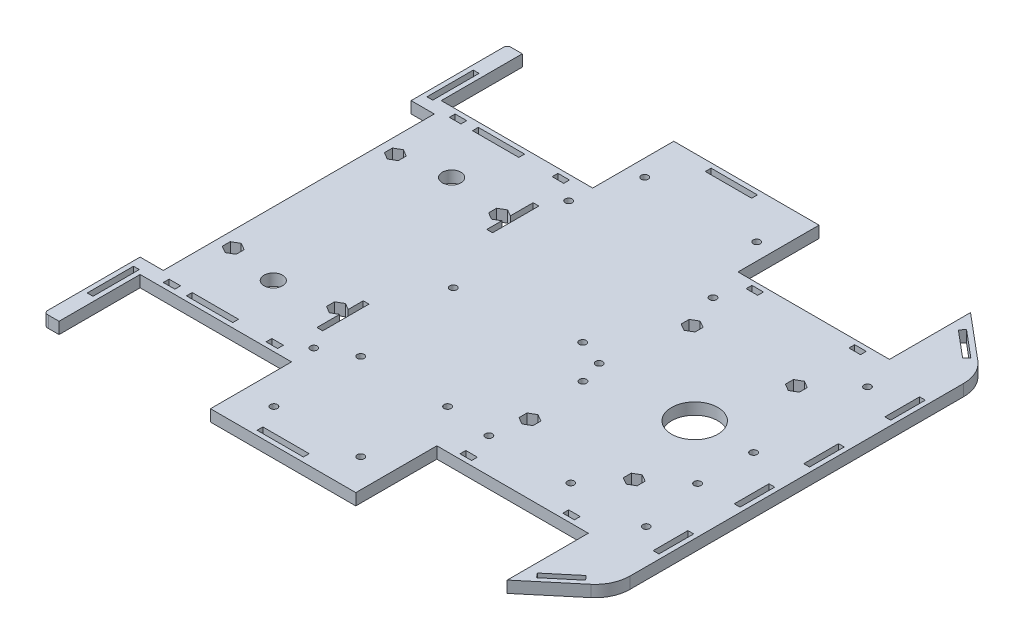
from build123d import *

# Parameters (mm, degrees)
SKETCH1_W           = 2.5
SKETCH1_H           = 20
SKETCH1_W_2         = 5
SKETCH1_H_2         = 2.5
SKETCH1_W_3         = 20
SKETCH1_R           = 1.5
SKETCH1_R_2         = 4
SKETCH1_H_3         = 15
SKETCH1_R_3         = 10
BOSS_EXTRUDE1_DEPTH = 2.5
FILLET1_SIZE        = 2
FILLET2_R           = 15


with BuildPart() as part:
    # Sketch1 → Boss-Extrude1 (new, symmetric)
    with BuildSketch(Plane(origin=(0, 0, 0), x_dir=(1, 0, 0), z_dir=(0, 1, 0))):
        Polygon((100, -65), (100, -100), (125, -79.022509221), (125, 79.022509221), (100, 100), (100, 65), (34.617, 65), (34.617, 100), (-28.117, 100), (-28.117, 65), (-93.5, 65), (-93.5, 100), (-100, 100), (-100, 58.5), (-90, 58.5), (-90, -58.5), (-100, -58.5), (-100, -100), (-93.5, -100), (-93.5, -65), (-28.117, -65), (-28.117, -100), (34.617, -100), (34.617, -65), align=None)
        with Locations((-96.75, -73.333333333)):
            Rectangle(SKETCH1_W, SKETCH1_H, mode=Mode.SUBTRACT)
        with Locations((-83, -61.75)):
            Rectangle(SKETCH1_W_2, SKETCH1_H_2, mode=Mode.SUBTRACT)
        with Locations((-65.5, -61.75)):
            Rectangle(SKETCH1_W_3, SKETCH1_H_2, mode=Mode.SUBTRACT)
        with Locations((0, -96.75)):
            Rectangle(SKETCH1_W_3, SKETCH1_H_2, mode=Mode.SUBTRACT)
        with Locations(Location((-15.248, -85.5, 0), (0, 0, 270))):
            Circle(SKETCH1_R, mode=Mode.SUBTRACT)
        with Locations((-38.617, -61.75)):
            Rectangle(SKETCH1_W_2, SKETCH1_H_2, mode=Mode.SUBTRACT)
        with Locations(Location((-28.5, -55, 0), (0, 0, 270))):
            Circle(SKETCH1_R, mode=Mode.SUBTRACT)
        Polygon((-86.3085, -36.732050808), (-86.3085, -33.267949192), (-83.3085, -31.535898385), (-80.3085, -33.267949192), (-80.3085, -36.732050808), (-83.3085, -38.464101615), align=None, mode=Mode.SUBTRACT)
        with Locations(Location((-62.5, -38.5, 0), (0, 0, 270))):
            Circle(SKETCH1_R_2, mode=Mode.SUBTRACT)
        Polygon((-33, -46.666666667), (-35.5, -46.666666667), (-35.5, -36.842613384), (-38.3085, -38.464101615), (-41.3085, -36.732050808), (-41.3085, -33.267949192), (-38.3085, -31.535898385), (-35.5, -33.157386616), (-35.5, -26.666666667), (-33, -26.666666667), align=None, mode=Mode.SUBTRACT)
        with Locations(Location((-15.248, -48, 0), (0, 0, 270))):
            Circle(SKETCH1_R, mode=Mode.SUBTRACT)
        with Locations(Location((-20.92, -2.37, 0), (0, 0, 270))):
            Circle(SKETCH1_R, mode=Mode.SUBTRACT)
        with Locations(Location((22.252, -85.5, 0), (0, 0, 270))):
            Circle(SKETCH1_R, mode=Mode.SUBTRACT)
        with Locations((45.117, -61.75)):
            Rectangle(SKETCH1_W_2, SKETCH1_H_2, mode=Mode.SUBTRACT)
        Polygon((105.469091457, -92.800072797), (103.862122433, -90.884961689), (115.35278908, -81.243147544), (116.959758104, -83.158258651), align=None, mode=Mode.SUBTRACT)
        with Locations((89.5, -61.75)):
            Rectangle(SKETCH1_W_2, SKETCH1_H_2, mode=Mode.SUBTRACT)
        with Locations((121.75, -50.007009332)):
            Rectangle(SKETCH1_W, SKETCH1_H_3, mode=Mode.SUBTRACT)
        with Locations(Location((22.252, -48, 0), (0, 0, 270))):
            Circle(SKETCH1_R, mode=Mode.SUBTRACT)
        with Locations(Location((42.055, -50, 0), (0, 0, 270))):
            Circle(SKETCH1_R, mode=Mode.SUBTRACT)
        Polygon((47.8085, -36.732050808), (44.8085, -38.464101615), (41.8085, -36.732050808), (41.8085, -33.267949192), (44.8085, -31.535898385), (47.8085, -33.267949192), align=None, mode=Mode.SUBTRACT)
        with Locations(Location((42.055, -9.36, 0), (0, 0, 270))):
            Circle(SKETCH1_R, mode=Mode.SUBTRACT)
        with Locations(Location((77.441, -50, 0), (0, 0, 270))):
            Circle(SKETCH1_R, mode=Mode.SUBTRACT)
        Polygon((89.8085, -31.535898385), (92.8085, -33.267949192), (92.8085, -36.732050808), (89.8085, -38.464101615), (86.8085, -36.732050808), (86.8085, -33.267949192), align=None, mode=Mode.SUBTRACT)
        with Locations(Location((110, -50, 0), (0, 0, 270))):
            Circle(SKETCH1_R, mode=Mode.SUBTRACT)
        with Locations(Location((105, -22.822, 0), (0, 0, 270))):
            Circle(SKETCH1_R, mode=Mode.SUBTRACT)
        with Locations((121.75, -15.007009332)):
            Rectangle(SKETCH1_W, SKETCH1_H_3, mode=Mode.SUBTRACT)
        Polygon((-80.3085, 36.732050808), (-80.3085, 33.267949192), (-83.3085, 31.535898385), (-86.3085, 33.267949192), (-86.3085, 36.732050808), (-83.3085, 38.464101615), align=None, mode=Mode.SUBTRACT)
        with Locations(Location((-62.5, 38.5, 0), (0, 0, 270))):
            Circle(SKETCH1_R_2, mode=Mode.SUBTRACT)
        Polygon((-33, 26.666666667), (-35.5, 26.666666667), (-35.5, 33.157386616), (-38.3085, 31.535898385), (-41.3085, 33.267949192), (-41.3085, 36.732050808), (-38.3085, 38.464101615), (-35.5, 36.842613384), (-35.5, 46.666666667), (-33, 46.666666667), align=None, mode=Mode.SUBTRACT)
        with Locations((-83, 61.75)):
            Rectangle(SKETCH1_W_2, SKETCH1_H_2, mode=Mode.SUBTRACT)
        with Locations((-96.75, 73.333333333)):
            Rectangle(SKETCH1_W, SKETCH1_H, mode=Mode.SUBTRACT)
        with Locations((-65.5, 61.75)):
            Rectangle(SKETCH1_W_3, SKETCH1_H_2, mode=Mode.SUBTRACT)
        with Locations((-38.617, 61.75)):
            Rectangle(SKETCH1_W_2, SKETCH1_H_2, mode=Mode.SUBTRACT)
        with Locations(Location((-28.5, 55, 0), (0, 0, 270))):
            Circle(SKETCH1_R, mode=Mode.SUBTRACT)
        with Locations(Location((-20.92, 80.26, 0), (0, 0, 270))):
            Circle(SKETCH1_R, mode=Mode.SUBTRACT)
        with Locations((0, 96.75)):
            Rectangle(SKETCH1_W_3, SKETCH1_H_2, mode=Mode.SUBTRACT)
        with Locations(Location((27.42, 5.13, 0), (0, 0, 270))):
            Circle(SKETCH1_R, mode=Mode.SUBTRACT)
        with Locations(Location((38.83, 0.851, 0), (0, 0, 270))):
            Circle(SKETCH1_R, mode=Mode.SUBTRACT)
        Polygon((47.8085, 36.732050808), (47.8085, 33.267949192), (44.8085, 31.535898385), (41.8085, 33.267949192), (41.8085, 36.732050808), (44.8085, 38.464101615), align=None, mode=Mode.SUBTRACT)
        with Locations(Location((80.93, 0, 0), (0, 0, 270))):
            Circle(SKETCH1_R_3, mode=Mode.SUBTRACT)
        with Locations(Location((105.5, 0.851, 0), (0, 0, 270))):
            Circle(SKETCH1_R, mode=Mode.SUBTRACT)
        with Locations((121.75, 15.007009332)):
            Rectangle(SKETCH1_W, SKETCH1_H_3, mode=Mode.SUBTRACT)
        Polygon((89.8085, 31.535898385), (86.8085, 33.267949192), (86.8085, 36.732050808), (89.8085, 38.464101615), (92.8085, 36.732050808), (92.8085, 33.267949192), align=None, mode=Mode.SUBTRACT)
        with Locations(Location((38.83, 50, 0), (0, 0, 270))):
            Circle(SKETCH1_R, mode=Mode.SUBTRACT)
        with Locations((45.117, 61.75)):
            Rectangle(SKETCH1_W_2, SKETCH1_H_2, mode=Mode.SUBTRACT)
        with Locations(Location((27.42, 80.26, 0), (0, 0, 270))):
            Circle(SKETCH1_R, mode=Mode.SUBTRACT)
        with Locations((89.5, 61.75)):
            Rectangle(SKETCH1_W_2, SKETCH1_H_2, mode=Mode.SUBTRACT)
        with Locations(Location((105.5, 50, 0), (0, 0, 270))):
            Circle(SKETCH1_R, mode=Mode.SUBTRACT)
        with Locations((121.75, 50.007009332)):
            Rectangle(SKETCH1_W, SKETCH1_H_3, mode=Mode.SUBTRACT)
        Polygon((116.959758104, 83.158258651), (115.35278908, 81.243147544), (103.862122433, 90.884961689), (105.469091457, 92.800072797), align=None, mode=Mode.SUBTRACT)
    extrude(amount=BOSS_EXTRUDE1_DEPTH, both=True)

    # Fillet1
    # a fillet whose section is not a circle: 2 mm, written as the material it takes off along each edge
    with BuildSketch(Plane(origin=(-100, -7.5, -100), x_dir=(0, 0, 1), z_dir=(0, 1, 0))) as fillet1_piece_1:
        with BuildLine():
            add(Edge.make_bspline([(FILLET1_SIZE, 0), (FILLET1_SIZE * 0.831801948466, 0), (FILLET1_SIZE * 0.663603896932, 0), (FILLET1_SIZE * 0.292893218813, FILLET1_SIZE * 0.0716919198361), (FILLET1_SIZE * 0.071691919836, FILLET1_SIZE * 0.292893218813), (0, FILLET1_SIZE * 0.663603896932), (0, FILLET1_SIZE * 0.831801948466), (0, FILLET1_SIZE)], knots=[0, 0, 0, 0, 0, 0, 0.5, 0.5, 1, 1, 1, 1, 1, 1], degree=5))
            Line((0, FILLET1_SIZE), (0, 0))
            Line((0, 0), (FILLET1_SIZE, 0))
        make_face()
    extrude(amount=15, mode=Mode.SUBTRACT)
    with BuildSketch(Plane(origin=(-100, 7.5, 100), x_dir=(1, 0, 0), z_dir=(0, -1, 0))) as fillet1_piece_2:
        with BuildLine():
            add(Edge.make_bspline([(FILLET1_SIZE, 0), (FILLET1_SIZE * 0.831801948466, 0), (FILLET1_SIZE * 0.663603896932, 0), (FILLET1_SIZE * 0.292893218813, -FILLET1_SIZE * 0.0716919198361), (FILLET1_SIZE * 0.0716919198361, -FILLET1_SIZE * 0.292893218813), (0, -FILLET1_SIZE * 0.663603896932), (0, -FILLET1_SIZE * 0.831801948466), (0, -FILLET1_SIZE)], knots=[0, 0, 0, 0, 0, 0, 0.5, 0.5, 1, 1, 1, 1, 1, 1], degree=5))
            Line((0, -FILLET1_SIZE), (0, 0))
            Line((0, 0), (FILLET1_SIZE, 0))
        make_face()
    extrude(amount=15, mode=Mode.SUBTRACT)

    # Fillet2
    fillet2_edges = [part.edges().sort_by_distance(p)[0] for p in [
        (125, 0, -79.022509221),
        (125, 0, 79.022509221),
    ]]
    fillet(fillet2_edges, radius=FILLET2_R)


solid = part.part
